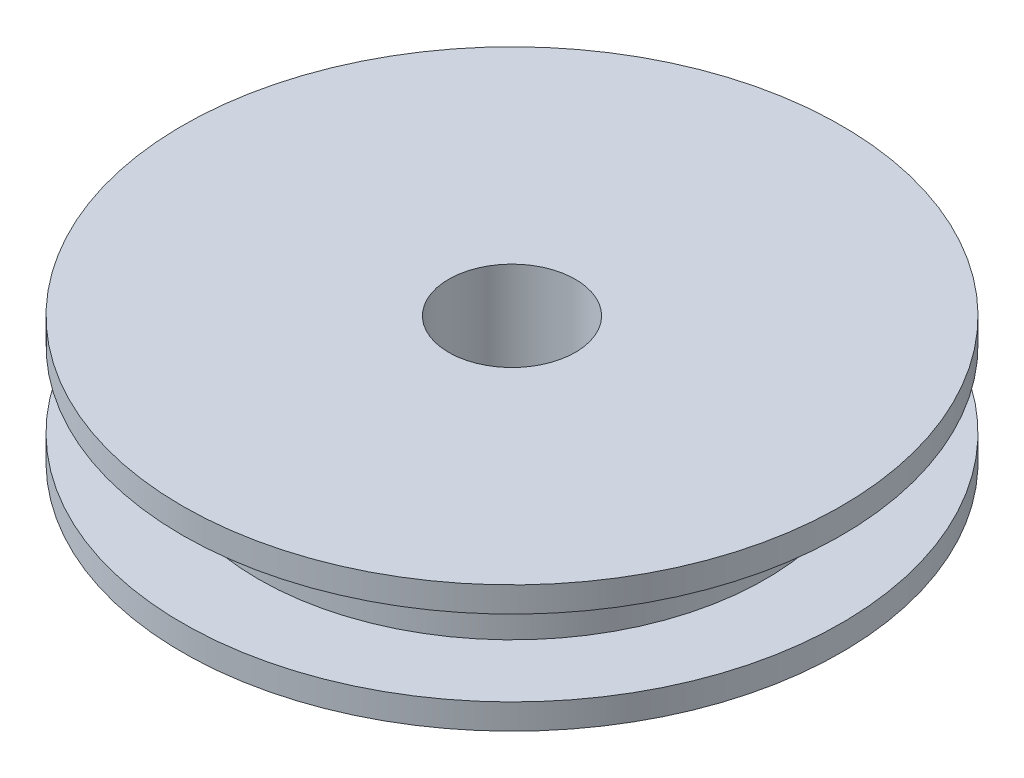
from build123d import *

# Parameters (mm, degrees)
SKETCH1_R           = 10
BOSS_EXTRUDE1_DEPTH = 1
SKETCH2_R           = 10
BOSS_EXTRUDE2_DEPTH = 4
SKETCH4_R           = 13
BOSS_EXTRUDE3_DEPTH = 1
CUT_SWEEP1_START    = 4.993438222
CUT_SWEEP1_DEPTH    = 4.55597903
SKETCH9_R           = 2.5
CUT_EXTRUDE2_DEPTH  = 5
SKETCH10_R          = 2.5
SKETCH10_R_2        = 1
BOSS_EXTRUDE4_DEPTH = 1
SKETCH11_R          = 13
SKETCH11_R_2        = 10
BOSS_EXTRUDE5_DEPTH = 1


# Read off the part's stored shape, not the designer's step: Cut-Sweep1
with BuildPart() as part:
    # Sketch1 → Boss-Extrude1 (new body)
    with BuildSketch(Plane(origin=(0, 0, 0), x_dir=(1, 0, 0), z_dir=(0, 1, 0))):
        with Locations(Location((0, 0, 0), (0, 0, 270))):
            Circle(SKETCH1_R)
    extrude(amount=BOSS_EXTRUDE1_DEPTH)

    # Sketch2 → Boss-Extrude2 (add)
    with BuildSketch(Plane(origin=(0, 0, 0), x_dir=(1, 0, 0), z_dir=(0, 1, 0))):
        with Locations(Location((0, 0, 0), (0, 0, 270))):
            Circle(SKETCH2_R)
    extrude(amount=BOSS_EXTRUDE2_DEPTH)

    # Sketch4 → Boss-Extrude3 (add)
    with BuildSketch(Plane(origin=(0, 4, 0), x_dir=(1, 0, 0), z_dir=(0, 1, 0))):
        with Locations(Location((0, 0, 0), (0, 0, 270))):
            Circle(SKETCH4_R)
    extrude(amount=BOSS_EXTRUDE3_DEPTH)

    # Cut-Sweep1 outline → Cut-Sweep1 (cut)
    with BuildSketch(Plane(origin=(0, 0, 0), x_dir=(1, 0, 0), z_dir=(0, 0.6401843996644766, 0.7682212795973786)).offset(CUT_SWEEP1_START)):
        with BuildLine():
            add(Edge.make_bspline(
                [(0, -4.801382997), (1, -4.801382997), (1, -4.161198598), (0, -4.161198598), (-1, -4.161198598), (-1, -4.801382997), (0, -4.801382997)],
                knots=[0, 0, 0, 0, 0.5, 0.5, 0.5, 1, 1, 1, 1], degree=3, weights=[1, 0.333333333, 0.333333333, 1, 0.333333333, 0.333333333, 1]))
        make_face()
    extrude(amount=CUT_SWEEP1_DEPTH, mode=Mode.SUBTRACT)

    # Sketch9 → Cut-Extrude2 (cut)
    with BuildSketch(Plane(origin=(0, 0, 0), x_dir=(1, 0, 0), z_dir=(0, 1, 0))):
        with Locations(Location((0, 0, 0), (0, 0, 270))):
            Circle(SKETCH9_R)
    extrude(amount=CUT_EXTRUDE2_DEPTH, mode=Mode.SUBTRACT)

    # Sketch10 → Boss-Extrude4 (add)
    with BuildSketch(Plane(origin=(0, 0, 0), x_dir=(1, 0, 0), z_dir=(0, 1, 0))):
        with Locations(Location((0, 0, 0), (0, 0, 270))):
            Circle(SKETCH10_R)
        with Locations(Location((0, 0, 0), (0, 0, 270))):
            Circle(SKETCH10_R_2, mode=Mode.SUBTRACT)
    extrude(amount=BOSS_EXTRUDE4_DEPTH)

    # Sketch11 → Boss-Extrude5 (add)
    with BuildSketch(Plane(origin=(0, 0, 0), x_dir=(-1, 0, 0), z_dir=(0, -1, 0))):
        with Locations(Location((0, 0, 0), (0, 0, 270))):
            Circle(SKETCH11_R)
        with Locations(Location((0, 0, 0), (0, 0, 90))):
            Circle(SKETCH11_R_2, mode=Mode.SUBTRACT)
    extrude(amount=-BOSS_EXTRUDE5_DEPTH)


solid = part.part
